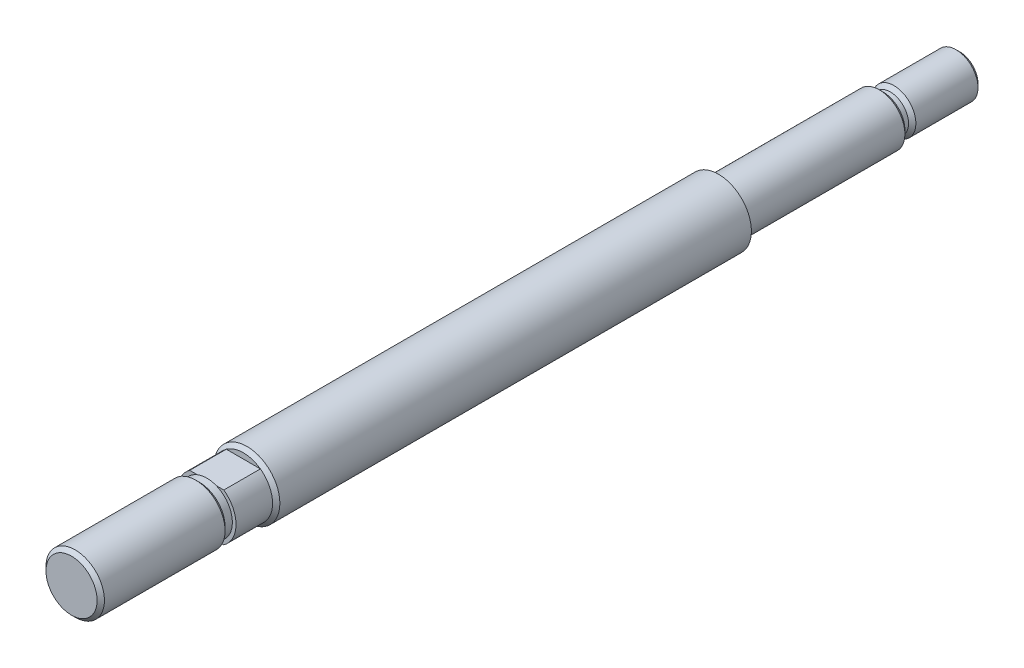
from build123d import *

# Parameters (mm, degrees)
SKETCH1_R           = 9
BOSS_EXTRUDE1_DEPTH = 121.5
SKETCH2_OUTSIDE_W   = 68.866
SKETCH2_OUTSIDE_H   = 68.866
SKETCH2_OUTSIDE_R   = 6
CUT_EXTRUDE2_DEPTH  = 19
SKETCH3_OUTSIDE_W   = 68.866
SKETCH3_OUTSIDE_H   = 68.866
SKETCH3_OUTSIDE_R   = 5
CUT_EXTRUDE3_DEPTH  = 2
SKETCH4_OUTSIDE_W   = 68.866
SKETCH4_OUTSIDE_H   = 68.866
SKETCH4_OUTSIDE_R   = 7
CUT_EXTRUDE4_DEPTH  = 45
CHAMFER1_SIZE       = 1
SKETCH5_OUTSIDE_W   = 68.866
SKETCH5_OUTSIDE_H   = 68.866
SKETCH5_OUTSIDE_R   = 6.5
CUT_EXTRUDE5_DEPTH  = 47
SKETCH6_R           = 8
BOSS_EXTRUDE2_DEPTH = 10
BOSS_EXTRUDE3_START = -35
SKETCH8_R           = 8
BOSS_EXTRUDE3_DEPTH = 35
CHAMFER3_SIZE       = 1
BOSS_EXTRUDE4_REACH = 210.389
SKETCH12_R          = 7
SKETCH14_W          = 10
SKETCH14_H          = 1.5
CUT_EXTRUDE7_DEPTH  = 17.5


with BuildPart() as part:
    # Sketch1 → Boss-Extrude1 (new, symmetric)
    with BuildSketch(Plane.XY):
        Circle(SKETCH1_R)
    extrude(amount=BOSS_EXTRUDE1_DEPTH, both=True)

    # Sketch2 outside → Cut-Extrude2 (cut)
    with BuildSketch(Plane(origin=(0, 0, -121.5), x_dir=(-1, 0, 0), z_dir=(0, 0, -1))):
        Rectangle(SKETCH2_OUTSIDE_W, SKETCH2_OUTSIDE_H)
        Circle(SKETCH2_OUTSIDE_R, mode=Mode.SUBTRACT)
    extrude(amount=-CUT_EXTRUDE2_DEPTH, mode=Mode.SUBTRACT)

    # Sketch3 outside → Cut-Extrude3 (cut)
    with BuildSketch(Plane(origin=(0, 0, -102.5), x_dir=(-1, 0, 0), z_dir=(0, 0, -1))):
        Rectangle(SKETCH3_OUTSIDE_W, SKETCH3_OUTSIDE_H)
        Circle(SKETCH3_OUTSIDE_R, mode=Mode.SUBTRACT)
    extrude(amount=-CUT_EXTRUDE3_DEPTH, mode=Mode.SUBTRACT)

    # Sketch4 outside → Cut-Extrude4 (cut)
    with BuildSketch(Plane(origin=(0, 0, -100.5), x_dir=(-1, 0, 0), z_dir=(0, 0, -1))):
        Rectangle(SKETCH4_OUTSIDE_W, SKETCH4_OUTSIDE_H)
        Circle(SKETCH4_OUTSIDE_R, mode=Mode.SUBTRACT)
    extrude(amount=-CUT_EXTRUDE4_DEPTH, mode=Mode.SUBTRACT)

    # Chamfer1
    chamfer1_edges = [part.edges().sort_by_distance(p)[0] for p in [
        (6, 0, -121.5),
        (6, 0, -102.5),
        (7, 0, -100.5),
    ]]
    chamfer(chamfer1_edges, length=CHAMFER1_SIZE - 0.0001)  # a hair under: the kernel refuses the full size

    # Sketch5 outside → Cut-Extrude5 (cut)
    with BuildSketch(Plane.XY.offset(121.5)):
        Rectangle(SKETCH5_OUTSIDE_W, SKETCH5_OUTSIDE_H)
        Circle(SKETCH5_OUTSIDE_R, mode=Mode.SUBTRACT)
    extrude(amount=-CUT_EXTRUDE5_DEPTH, mode=Mode.SUBTRACT)

    # Sketch6 → Boss-Extrude2 (add)
    with BuildSketch(Plane.XY.offset(74.5)):
        Circle(SKETCH6_R)
    extrude(amount=BOSS_EXTRUDE2_DEPTH)

    # Sketch8 → Boss-Extrude3 (add)
    with BuildSketch(Plane.XY.offset(121.5).offset(BOSS_EXTRUDE3_START)):
        Circle(SKETCH8_R)
    extrude(amount=BOSS_EXTRUDE3_DEPTH)

    # Chamfer3
    chamfer3_edges = [part.edges().sort_by_distance(p)[0] for p in [
        (-9, 0, 74.5),
        (-8, 0, 86.5),
        (-8, 0, 121.5),
    ]]
    chamfer(chamfer3_edges, length=CHAMFER3_SIZE - 0.0001)  # a hair under: the kernel refuses the full size

    # Sketch12 → Boss-Extrude4 (add, up to next)
    with BuildSketch(Plane(origin=(0, 0, 86.5), x_dir=(-1, 0, 0), z_dir=(0, 0, -1)), mode=Mode.PRIVATE) as boss_extrude4_sk1:
        Circle(SKETCH12_R)
    boss_extrude4_tool1 = extrude(boss_extrude4_sk1.sketch, amount=BOSS_EXTRUDE4_REACH, mode=Mode.PRIVATE) - part.part
    add(boss_extrude4_tool1.solids().sort_by_distance((0, 0, 86.5))[0])

    # Sketch14 → Cut-Extrude7 (cut, symmetric)
    with BuildSketch(Plane(origin=(0, 0, 0), x_dir=(0, 0, -1), z_dir=(1, 0, 0))):
        with Locations((-79.5, 7.25)):
            Rectangle(SKETCH14_W, SKETCH14_H)
        with Locations((-79.5, -7.25)):
            Rectangle(SKETCH14_W, SKETCH14_H)
    extrude(amount=CUT_EXTRUDE7_DEPTH, both=True, mode=Mode.SUBTRACT)


solid = part.part
